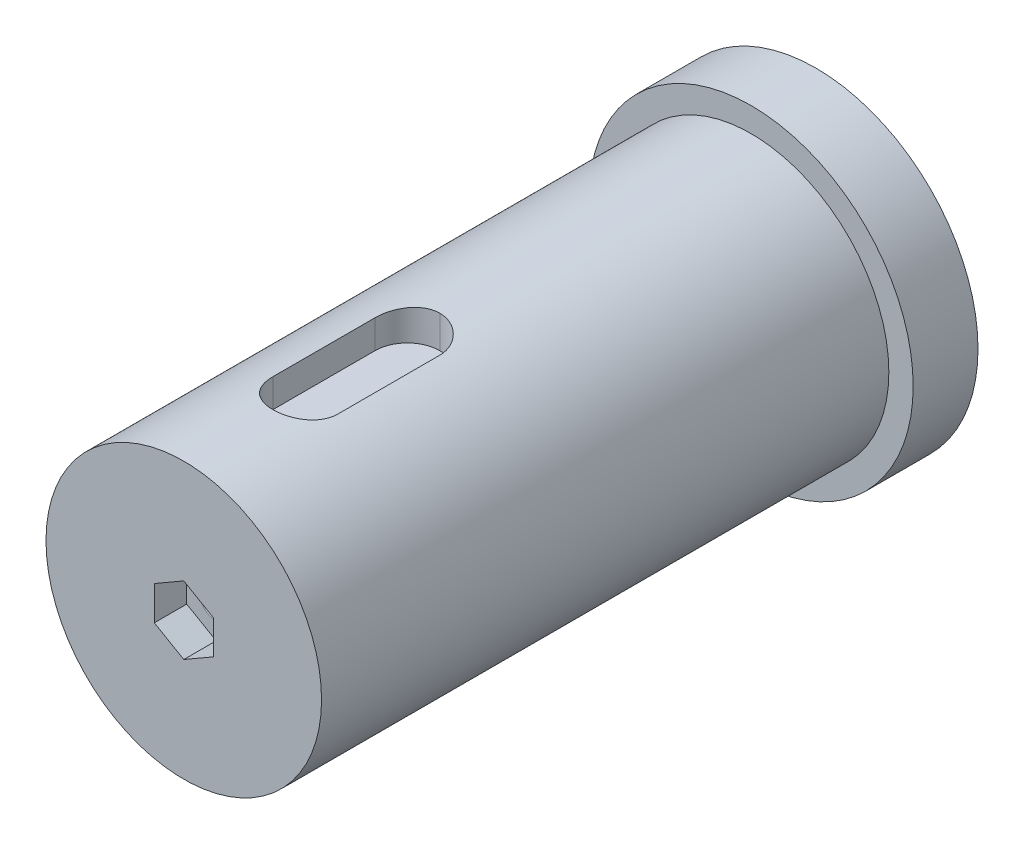
from build123d import *
from build123d.topology import SkipClean

# Parameters (mm, degrees)
SKETCH_1_R           = 8.5
EXTRUDE_1_DEPTH      = 35
SKETCH_3_W           = 4
SKETCH_3_H           = 4
CUT_EXTRUDE_1_DEPTH  = 14
EXTRUDE_2_REACH      = 41.016
EXTRUDE_2_END_RADIUS = 8.5
EXTRUDE_3_REACH      = 41.016
EXTRUDE_3_END_RADIUS = 8.5
SKETCH_6_R           = 10
SKETCH_6_R_2         = 8.5
EXTRUDE_4_DEPTH      = 7
SKETCH_7_R           = 8.5
EXTRUDE_5_DEPTH      = 3
EXTRUDE_6_REACH      = 44.617
EXTRUDE_6_END_RADIUS = 8.5
CUT_EXTRUDE_2_DEPTH  = 43.617484675
FILLET_1_R           = 2
CUT_EXTRUDE_START    = -3
SKETCH_10_R          = 10
SKETCH_10_R_2        = 8.5
CUT_EXTRUDE_3_DEPTH  = 3
SKETCH_11_R          = 8.5
EXTRUDE_7_DEPTH      = 1
SKETCH_12_R          = 1
CUT_EXTRUDE_4_DEPTH  = 5
CUT_EXTRUDE_5_DEPTH  = 2
EXTRUDE_START        = 3
SKETCH_14_R          = 1
SKETCH_14_R_2        = 0.85
EXTRUDE_8_DEPTH      = 3
FILLET_2_R           = 0.2
SKETCH_15_W          = 8
SKETCH_15_H          = 8
CUT_EXTRUDE_6_DEPTH  = 6


with BuildPart() as part:
    # 草图1 → 凸台-拉伸1 (new body)
    with BuildSketch(Plane.XY):
        Circle(SKETCH_1_R)
    extrude(amount=EXTRUDE_1_DEPTH)

    # 草图3 → 切除-拉伸1 (cut)
    with BuildSketch(Plane.XY.offset(35)):
        with Locations((0, 8.5)):
            Rectangle(SKETCH_3_W, SKETCH_3_H)
    extrude(amount=-CUT_EXTRUDE_1_DEPTH, mode=Mode.SUBTRACT)

    # 凸台-拉伸2: up to this cylinder (the profile starts inside it)
    with SkipClean():  # the faces are left unmerged after this step: merging them gives an invalid solid
        extrude_2_end = Plane(origin=(0, 0, 21.446736), z_dir=(0, 0, -1)) * Cylinder(EXTRUDE_2_END_RADIUS, 100.032, mode=Mode.PRIVATE)
        # 草图4 → 凸台-拉伸2 (add, up to the surface)
        with BuildSketch(Plane(origin=(0, 6.5, 0), x_dir=(1, 0, 0), z_dir=(0, 1, 0)), mode=Mode.PRIVATE) as extrude_2_sk1:
            with BuildLine():
                Line((2, -21), (0, -21))
                ThreePointArc((0, -21), (1.414213562, -21.585786438), (2, -23))
                Line((2, -23), (2, -21))
            make_face()
        extrude_2_tool1 = extrude(extrude_2_sk1.sketch, amount=EXTRUDE_2_REACH, mode=Mode.PRIVATE) & extrude_2_end
        add(extrude_2_tool1.solids().sort_by_distance((1.553264, 6.5, 21.446736))[0])
        # 草图4 → 凸台-拉伸2 (add, up to the surface)
        with BuildSketch(Plane(origin=(0, 6.5, 0), x_dir=(1, 0, 0), z_dir=(0, 1, 0)), mode=Mode.PRIVATE) as extrude_2_sk2:
            with BuildLine():
                Line((-2, -21), (-2, -23))
                ThreePointArc((-2, -23), (-1.414213562, -21.585786438), (0, -21))
                Line((0, -21), (-2, -21))
            make_face()
        extrude_2_tool2 = extrude(extrude_2_sk2.sketch, amount=EXTRUDE_2_REACH, mode=Mode.PRIVATE) & extrude_2_end
        add(extrude_2_tool2.solids().sort_by_distance((-1.553264, 6.5, 21.446736))[0])

    # 凸台-拉伸3: up to this cylinder (the profile starts inside it)
    with SkipClean():  # the faces are left unmerged after this step: merging them gives an invalid solid
        extrude_3_end = Plane(origin=(0, 0, 32.762904), z_dir=(0, 0, -1)) * Cylinder(EXTRUDE_3_END_RADIUS, 100.032, mode=Mode.PRIVATE)
        # 草图5 → 凸台-拉伸3 (add, up to the surface)
        with BuildSketch(Plane(origin=(0, 6.5, 0), x_dir=(1, 0, 0), z_dir=(0, 1, 0)), mode=Mode.PRIVATE) as extrude_3_sk1:
            with BuildLine():
                Line((-2, -29), (-2, -35))
                Line((-2, -35), (2, -35))
                Line((2, -35), (2, -29))
                ThreePointArc((2, -29), (0, -31), (-2, -29))
            make_face()
        extrude_3_tool1 = extrude(extrude_3_sk1.sketch, amount=EXTRUDE_3_REACH, mode=Mode.PRIVATE) & extrude_3_end
        add(extrude_3_tool1.solids().sort_by_distance((0, 6.5, 32.762904))[0])

    # 草图6 → 凸台-拉伸4 (add)
    with BuildSketch(Plane(origin=(0, 0, 0), x_dir=(-1, 0, 0), z_dir=(0, 0, -1))):
        Circle(SKETCH_6_R)
        Circle(SKETCH_6_R_2, mode=Mode.SUBTRACT)
    extrude(amount=-EXTRUDE_4_DEPTH)

    # 草图7 → 凸台-拉伸5 (add)
    with SkipClean():  # the faces are left unmerged after this step: merging them gives an invalid solid
        with BuildSketch(Plane.XY.offset(35)):
            with Locations(Location((0, 0, 0), (0, 0, 180))):
                Circle(SKETCH_7_R)
        extrude(amount=EXTRUDE_5_DEPTH)

    # 凸台-拉伸6: up to this cylinder (the profile starts inside it)
    with SkipClean():  # the faces are left unmerged after this step: merging them gives an invalid solid
        extrude_6_end = Plane(origin=(0, 0, 22.258337), z_dir=(0, 0, -1)) * Cylinder(EXTRUDE_6_END_RADIUS, 107.234, mode=Mode.PRIVATE)
        # 草图8 → 凸台-拉伸6 (add, up to the surface)
        with BuildSketch(Plane(origin=(0, 6.5, 0), x_dir=(1, 0, 0), z_dir=(0, 1, 0)), mode=Mode.PRIVATE) as extrude_6_sk1:
            with BuildLine():
                Line((-2, -23), (-2, -23.2))
                Line((-2, -23.2), (2, -23.2))
                Line((2, -23.2), (2, -23))
                ThreePointArc((2, -23), (0, -21), (-2, -23))
            make_face()
        extrude_6_tool1 = extrude(extrude_6_sk1.sketch, amount=EXTRUDE_6_REACH, mode=Mode.PRIVATE) & extrude_6_end
        add(extrude_6_tool1.solids().sort_by_distance((0, 6.5, 22.258337))[0])

    # 草图9 → 切除-拉伸2 (cut, through all)
    with SkipClean():  # the faces are left unmerged after this step: merging them gives an invalid solid
        with BuildSketch(Plane(origin=(0, 6.5, 0), x_dir=(1, 0, 0), z_dir=(0, 1, 0))):
            with BuildLine():
                Line((-2, -29), (-2, -29.5))
                Line((-2, -29.5), (-2, -31.5))
                ThreePointArc((-2, -31.5), (0, -33.5), (2, -31.5))
                Line((2, -31.5), (2, -29.5))
                Line((2, -29.5), (2, -29))
                Line((2, -29), (-2, -29))
            make_face()
        extrude(amount=CUT_EXTRUDE_2_DEPTH, mode=Mode.SUBTRACT)

    # 圆角1
    # the kernel refuses this fillet: 2 mm, written as the material it adds along each edge
    with BuildSketch(Plane(origin=(-2, 1.5, 23.2), x_dir=(0, 0, 1), z_dir=(0, 1, 0))) as fillet_1_piece_1_section:
        with BuildLine():
            CenterArc((FILLET_1_R, FILLET_1_R), FILLET_1_R, 180, 90)
            Line((0, FILLET_1_R), (0, 0))
            Line((0, 0), (FILLET_1_R, 0))
        make_face()
    fillet_1_piece_1 = extrude(amount=11.761355821, mode=Mode.PRIVATE)
    fillet_1_piece_1 = fillet_1_piece_1 & Plane(origin=(0, 0, 23.652790229), x_dir=(1, 0, 0), z_dir=(0, 0, -1)) * Cylinder(8.5, 32, mode=Mode.PRIVATE)
    add(fillet_1_piece_1)
    with BuildSketch(Plane(origin=(2, 1.5, 23.2), x_dir=(0, 0, 1), z_dir=(0, 1, 0))) as fillet_1_piece_2_section:
        with BuildLine():
            CenterArc((FILLET_1_R, -FILLET_1_R), FILLET_1_R, 90, 90)
            Line((0, -FILLET_1_R), (0, 0))
            Line((0, 0), (FILLET_1_R, 0))
        make_face()
    fillet_1_piece_2 = extrude(amount=11.761355821, mode=Mode.PRIVATE)
    fillet_1_piece_2 = fillet_1_piece_2 & Plane(origin=(0, 0, 23.652790229), x_dir=(1, 0, 0), z_dir=(0, 0, -1)) * Cylinder(8.5, 32, mode=Mode.PRIVATE)
    add(fillet_1_piece_2)

    # 草图10 → 切除-拉伸3 (cut)
    with BuildSketch(Plane.XY.offset(7).offset(CUT_EXTRUDE_START)):
        with Locations(Location((0, 0, 0), (0, 0, 180))):
            Circle(SKETCH_10_R)
        Circle(SKETCH_10_R_2, mode=Mode.SUBTRACT)
    extrude(amount=CUT_EXTRUDE_3_DEPTH, mode=Mode.SUBTRACT)

    # 草图11 → 凸台-拉伸7 (add)
    with BuildSketch(Plane.XY.offset(38)):
        Circle(SKETCH_11_R)
    extrude(amount=EXTRUDE_7_DEPTH)

    # 草图12 → 切除-拉伸4 (cut)
    with BuildSketch(Plane.XY.offset(39)):
        Circle(SKETCH_12_R)
    extrude(amount=-CUT_EXTRUDE_4_DEPTH, mode=Mode.SUBTRACT)

    # 草图13 → 切除-拉伸5 (cut)
    with BuildSketch(Plane.XY.offset(39)):
        Polygon((0, 2.1), (-1.818653348, 1.05), (-1.818653348, -1.05), (0, -2.1), (1.818653348, -1.05), (1.818653348, 1.05), align=None)
    extrude(amount=-CUT_EXTRUDE_5_DEPTH, mode=Mode.SUBTRACT)

    # 草图14 → 凸台-拉伸8 (add)
    with BuildSketch(Plane.XY.offset(34).offset(EXTRUDE_START)):
        Circle(SKETCH_14_R)
        Circle(SKETCH_14_R_2, mode=Mode.SUBTRACT)
    extrude(amount=-EXTRUDE_8_DEPTH)

    # 圆角2
    fillet_2_edges = [part.edges().sort_by_distance(p)[0] for p in [
        (-0.85, 0, 37),
    ]]
    fillet(fillet_2_edges, radius=FILLET_2_R)

    # 草图15 → 切除-拉伸6 (cut)
    with BuildSketch(Plane(origin=(0, 0, 0), x_dir=(-1, 0, 0), z_dir=(0, 0, -1))):
        Rectangle(SKETCH_15_W, SKETCH_15_H)
    extrude(amount=-CUT_EXTRUDE_6_DEPTH, mode=Mode.SUBTRACT)


solid = part.part
